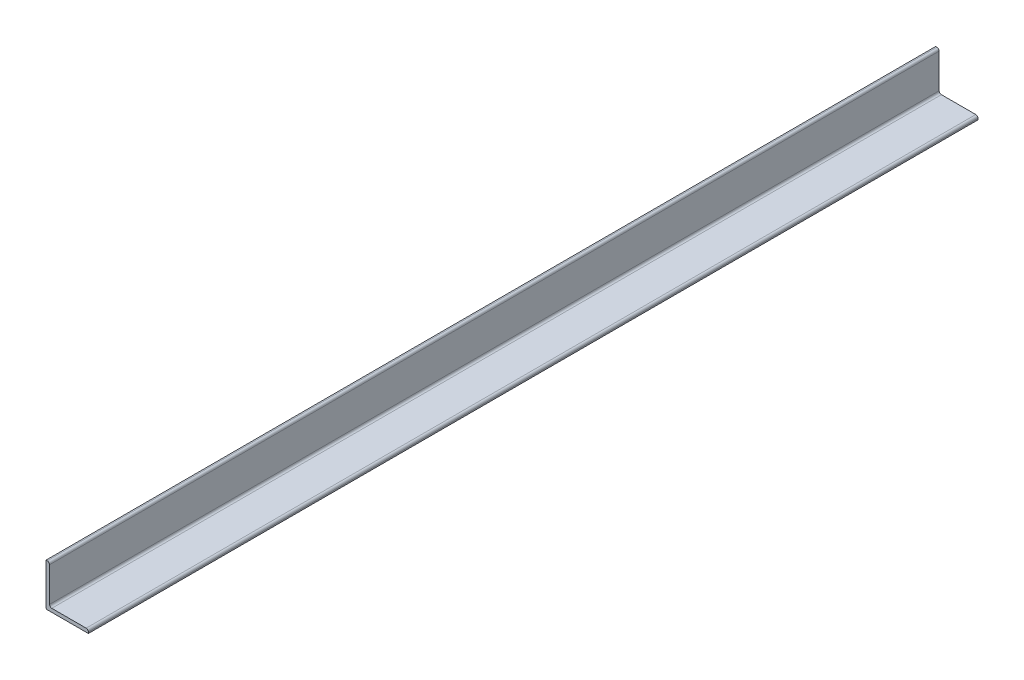
from build123d import *

# Parameters (mm, degrees)
BOSS_EXTRUDE1_DEPTH = 400
FILLET1_R           = 1
FILLET2_R           = 0.5


with BuildPart() as part:
    # Sketch1 → Boss-Extrude1 (new body)
    with BuildSketch(Plane.XY):
        Polygon((0, 0), (0, 19.05), (1.5875, 19.05), (1.5875, 1.5875), (19.05, 1.5875), (19.05, 0), align=None)
    extrude(amount=BOSS_EXTRUDE1_DEPTH)

    # Fillet1
    fillet1_edges = [part.edges().sort_by_distance(p)[0] for p in [
        (19.05, 1.5875, 200),
        (1.5875, 1.5875, 200),
        (1.5875, 19.05, 200),
    ]]
    fillet(fillet1_edges, radius=FILLET1_R)

    # Fillet2
    fillet2_edges = [part.edges().sort_by_distance(p)[0] for p in [
        (0, 0, 200),
    ]]
    fillet(fillet2_edges, radius=FILLET2_R)


solid = part.part
